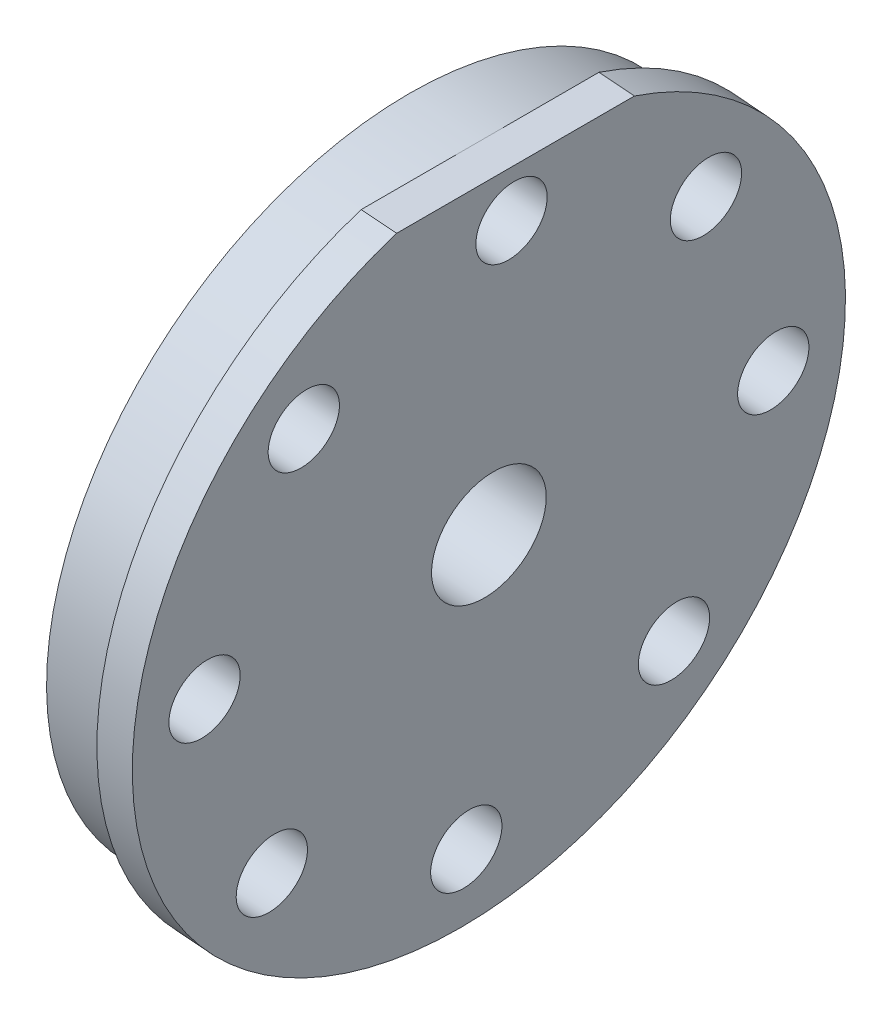
from build123d import *

# Parameters (mm, degrees)
SKETCH1_R           = 14.9606
BOSS_EXTRUDE1_DEPTH = 4.7625
SKETCH2_R           = 2.5527
CUT_EXTRUDE1_DEPTH  = 6.35
SKETCH3_R           = 1.5875
CUT_EXTRUDE2_DEPTH  = 10
SKETCH5_R           = 15.875
SKETCH5_R_2         = 14.9606
BOSS_EXTRUDE2_DEPTH = 1.5875
CUT_EXTRUDE3_DEPTH  = 2.54


with BuildPart() as part:
    # Sketch1 → Boss-Extrude1 (new body)
    with BuildSketch(Plane(origin=(234.278878836, -18.689027227, 0), x_dir=(0, 0, -1), z_dir=(0.9968332748770866, -0.0795199477981641, 0))):
        with Locations((-43.174261814, 8.550344032)):
            Circle(SKETCH1_R)
    extrude(amount=-BOSS_EXTRUDE1_DEPTH)

    # Sketch2 → Cut-Extrude1 (cut)
    with BuildSketch(Plane(origin=(234.278878836, -18.689027227, 0), x_dir=(0, 0, -1), z_dir=(0.9968332748770866, -0.07951994779816411, 0))):
        with Locations((-43.174261814, 8.550344032)):
            Circle(SKETCH2_R)
    extrude(amount=-CUT_EXTRUDE1_DEPTH, mode=Mode.SUBTRACT)

    # Sketch3 → Cut-Extrude2 (cut)
    with BuildSketch(Plane(origin=(229.531460364, -18.310313476, 0), x_dir=(0, 0, 1), z_dir=(-0.9968332748770866, 0.07951994779816411, 0))):
        with Locations((43.174261814, 21.250344032)):
            Circle(SKETCH3_R)
        with Locations((52.154517935, 17.530600153)):
            Circle(SKETCH3_R)
        with Locations((55.874261814, 8.550344032)):
            Circle(SKETCH3_R)
        with Locations((52.154517935, -0.429912089)):
            Circle(SKETCH3_R)
        with Locations((43.174261814, -4.149655968)):
            Circle(SKETCH3_R)
        with Locations((34.194005693, -0.429912089)):
            Circle(SKETCH3_R)
        with Locations((30.474261814, 8.550344032)):
            Circle(SKETCH3_R)
        with Locations((34.194005693, 17.530600153)):
            Circle(SKETCH3_R)
    extrude(amount=-CUT_EXTRUDE2_DEPTH, mode=Mode.SUBTRACT)

    # Sketch5 → Boss-Extrude2 (add)
    with BuildSketch(Plane(origin=(234.278878836, -18.689027227, 0), x_dir=(0, 0, 1), z_dir=(-0.9968332748770866, 0.07951994779816411, 0))):
        with Locations((43.174261814, 8.550344032)):
            Circle(SKETCH5_R)
        with Locations((43.174261814, 8.550344032)):
            Circle(SKETCH5_R_2, mode=Mode.SUBTRACT)
    extrude(amount=BOSS_EXTRUDE2_DEPTH)

    # Sketch6 → Cut-Extrude3 (cut)
    with BuildSketch(Plane(origin=(234.278878836, -18.689027227, 0), x_dir=(0, 0, -1), z_dir=(0.9968332748770866, -0.07951994779816411, 0))):
        with BuildLine():
            ThreePointArc((-37.864264391, 23.510944032), (-43.174261814, 24.425344032), (-48.484259238, 23.510944032))
            Line((-48.484259238, 23.510944032), (-37.864264391, 23.510944032))
        make_face()
    extrude(amount=-CUT_EXTRUDE3_DEPTH, mode=Mode.SUBTRACT)


solid = part.part
